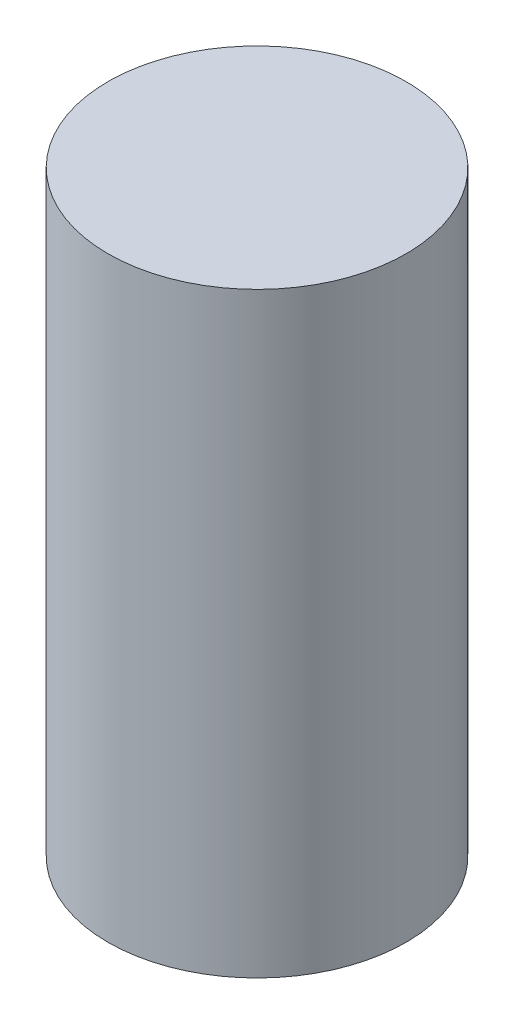
from build123d import *

# Parameters (mm, degrees)
BOSS_EXTRUDE1_DEPTH      = 5
BOSS_EXTRUDE1_DEPTH_BACK = 5
SKETCH1_R                = 2.5


with BuildPart() as part:
    # Sketch1 → Boss-Extrude1 (new, two sides: drawn at the far end of the back side and taken through both)
    with BuildSketch(Plane(origin=(0, 0, 0), x_dir=(1, 0, 0), z_dir=(0, 1, 0)).offset(-BOSS_EXTRUDE1_DEPTH_BACK)):
        Circle(SKETCH1_R)
    extrude(amount=BOSS_EXTRUDE1_DEPTH + BOSS_EXTRUDE1_DEPTH_BACK)


solid = part.part
